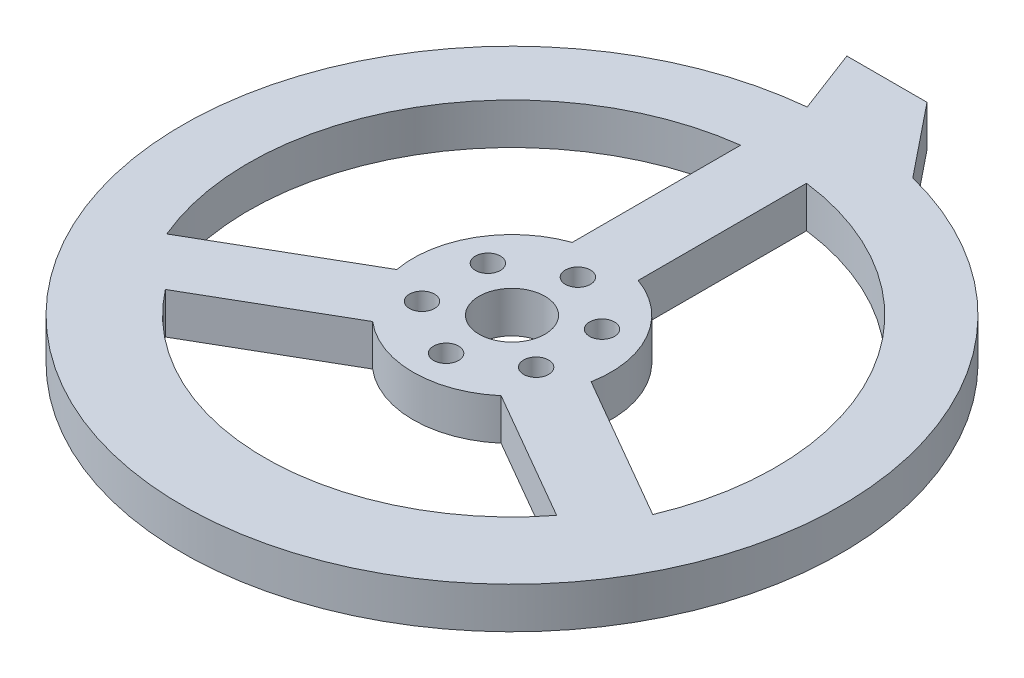
from build123d import *

# Parameters (mm, degrees)
SKETCH1_R           = 4.826
SKETCH1_R_2         = 12.7
BOSS_EXTRUDE1_DEPTH = 15.875


with BuildPart() as part:
    # Sketch1 → Boss-Extrude1 (new body)
    with BuildSketch(Plane(origin=(0, 0, 0), x_dir=(1, 0, 0), z_dir=(0, 1, 0))):
        with BuildLine():
            Line((-21.997045256, 151.045298411), (-12.611633593, 126.372254463))
            ThreePointArc((-12.611633593, 126.372254463), (-9.545717372, -126.640748892), (31.412465018, 123.053878612))
            Line((31.412465018, 123.053878612), (8.898896309, 151.045298411))
            Line((8.898896309, 151.045298411), (-21.997045256, 151.045298411))
        make_face()
        with BuildLine():
            Line((-75.402396754, -58.198290901), (-24.758519733, -28.95903487))
            ThreePointArc((-24.758519733, -28.95903487), (0, -38.1), (24.758519733, -28.95903487))
            Line((24.758519733, -28.95903487), (75.402396754, -58.198290901))
            ThreePointArc((75.402396754, -58.198290901), (0, -95.25), (-75.402396754, -58.198290901))
        make_face(mode=Mode.SUBTRACT)
        with BuildLine():
            ThreePointArc((12.7, 100.803124952), (87.988181024, 50.8), (93.648066989, -39.403039848))
            Line((93.648066989, -39.403039848), (37.458519733, -6.961989614))
            ThreePointArc((37.458519733, -6.961989614), (32.995567884, 19.05), (12.7, 35.921024484))
            Line((12.7, 35.921024484), (12.7, 100.803124952))
        make_face(mode=Mode.SUBTRACT)
        with BuildLine():
            ThreePointArc((-93.648066989, -39.403039848), (-87.988181024, 50.8), (-12.7, 100.803124952))
            Line((-12.7, 100.803124952), (-12.7, 35.921024484))
            ThreePointArc((-12.7, 35.921024484), (-32.995567884, 19.05), (-37.458519733, -6.961989614))
            Line((-37.458519733, -6.961989614), (-93.648066989, -39.403039848))
        make_face(mode=Mode.SUBTRACT)
        with Locations((-21.997045256, 12.7)):
            Circle(SKETCH1_R, mode=Mode.SUBTRACT)
        with Locations((0, 25.4)):
            Circle(SKETCH1_R, mode=Mode.SUBTRACT)
        with Locations((21.997045256, 12.7)):
            Circle(SKETCH1_R, mode=Mode.SUBTRACT)
        with Locations((-21.997045256, -12.7)):
            Circle(SKETCH1_R, mode=Mode.SUBTRACT)
        Circle(SKETCH1_R_2, mode=Mode.SUBTRACT)
        with Locations((0, -25.4)):
            Circle(SKETCH1_R, mode=Mode.SUBTRACT)
        with Locations((21.997045256, -12.7)):
            Circle(SKETCH1_R, mode=Mode.SUBTRACT)
    extrude(amount=BOSS_EXTRUDE1_DEPTH)


solid = part.part
